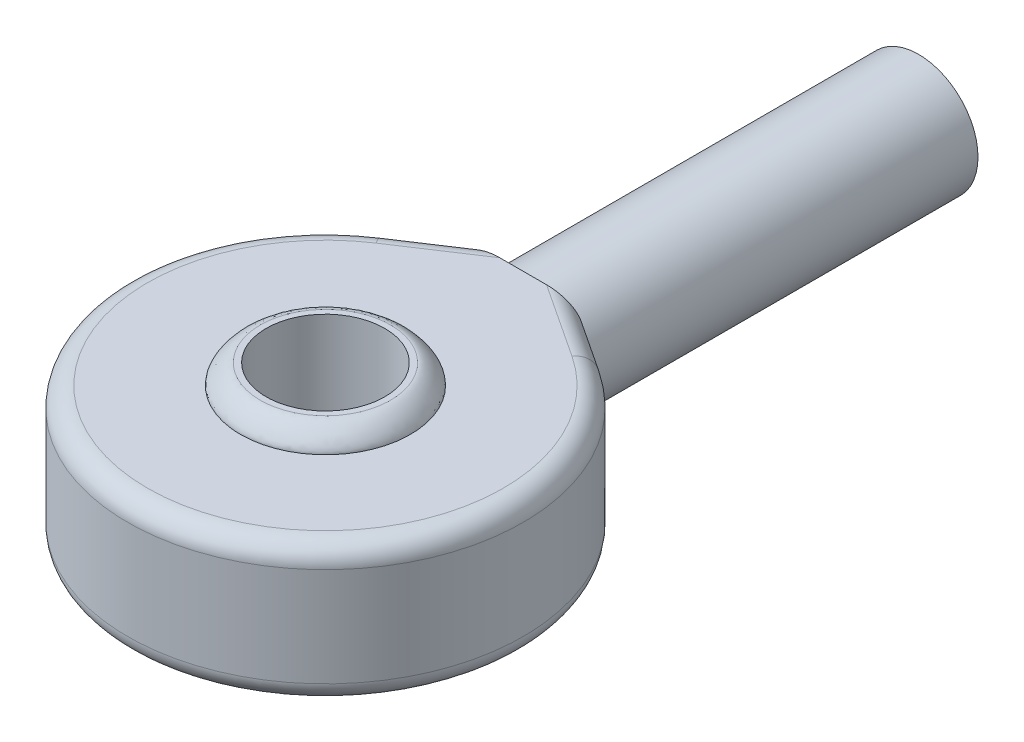
from build123d import *

# Parameters (mm, degrees)
CROQUIS1_R              = 3
SALIENTE_EXTRUIR1_DEPTH = 20
CROQUIS2_R              = 3
SALIENTE_EXTRUIR2_DEPTH = 3.5
REDONDEO2_R             = 1
CROQUIS3_R              = 4.296610541
CROQUIS3_R_2            = 3
SALIENTE_EXTRUIR3_DEPTH = 4.5
REDONDEO3_SIZE          = 1


with BuildPart() as part:
    # Croquis1 → Saliente-Extruir1 (new body)
    with BuildSketch(Plane.XY):
        Circle(CROQUIS1_R)
    extrude(amount=SALIENTE_EXTRUIR1_DEPTH)

    # Croquis2 → Saliente-Extruir2 (add, symmetric)
    with BuildSketch(Plane(origin=(0, 0, 0), x_dir=(1, 0, 0), z_dir=(0, 1, 0))):
        with BuildLine():
            Line((-5.504587156, -21.651376147), (-3, -20))
            Line((-3, -20), (3, -20))
            Line((3, -20), (5.504587156, -21.651376147))
            ThreePointArc((5.504587156, -21.651376147), (0, -40), (-5.504587156, -21.651376147))
        make_face()
        with Locations(Location((0, -30, 0), (0, 0, 90))):
            Circle(CROQUIS2_R, mode=Mode.SUBTRACT)
    extrude(amount=SALIENTE_EXTRUIR2_DEPTH, both=True)

    # Redondeo2
    redondeo2_edges = [part.edges().sort_by_distance(p)[0] for p in [
        (0, 3.5, 40),
        (4.252293578, 3.5, 20.825688073),
        (-4.252293578, 3.5, 20.825688073),
        (0, -3.5, 40),
        (4.252293578, -3.5, 20.825688073),
        (-4.252293578, -3.5, 20.825688073),
    ]]
    fillet(redondeo2_edges, radius=REDONDEO2_R)

    # Croquis3 → Saliente-Extruir3 (add, symmetric)
    with BuildSketch(Plane(origin=(0, 0, 0), x_dir=(1, 0, 0), z_dir=(0, 1, 0))):
        with Locations(Location((0, -30, 0), (0, 0, 270))):
            Circle(CROQUIS3_R)
        with Locations(Location((0, -30, 0), (0, 0, 90))):
            Circle(CROQUIS3_R_2, mode=Mode.SUBTRACT)
    extrude(amount=SALIENTE_EXTRUIR3_DEPTH, both=True)

    # Redondeo3
    # a fillet whose section is not a circle: 1 mm, written as the material it takes off along each edge
    with BuildSketch(Plane(origin=(0, -4.5, 30), x_dir=(0, 0, 1), z_dir=(-1, 0, 0))) as redondeo3_piece_1:
        with BuildLine():
            Bezier((4.296610541 - REDONDEO3_SIZE, 0), (4.296610541, 0), (4.296610541, REDONDEO3_SIZE), weights=[1, 0.353553391, 1])
            Line((4.296610541, REDONDEO3_SIZE), (4.296610541, 0))
            Line((4.296610541, 0), (4.296610541 - REDONDEO3_SIZE, 0))
        make_face()
    revolve(axis=Axis((0, -4.5, 30), (0, 1, 0)), mode=Mode.SUBTRACT)
    with BuildSketch(Plane(origin=(0, 4.5, 30), x_dir=(0, 0, 1), z_dir=(-1, 0, 0))) as redondeo3_piece_2:
        with BuildLine():
            Bezier((4.296610541, -REDONDEO3_SIZE), (4.296610541, 0), (4.296610541 - REDONDEO3_SIZE, 0), weights=[1, 0.353553391, 1])
            Line((4.296610541 - REDONDEO3_SIZE, 0), (4.296610541, 0))
            Line((4.296610541, 0), (4.296610541, -REDONDEO3_SIZE))
        make_face()
    revolve(axis=Axis((0, 4.5, 30), (0, 1, 0)), mode=Mode.SUBTRACT)


solid = part.part
